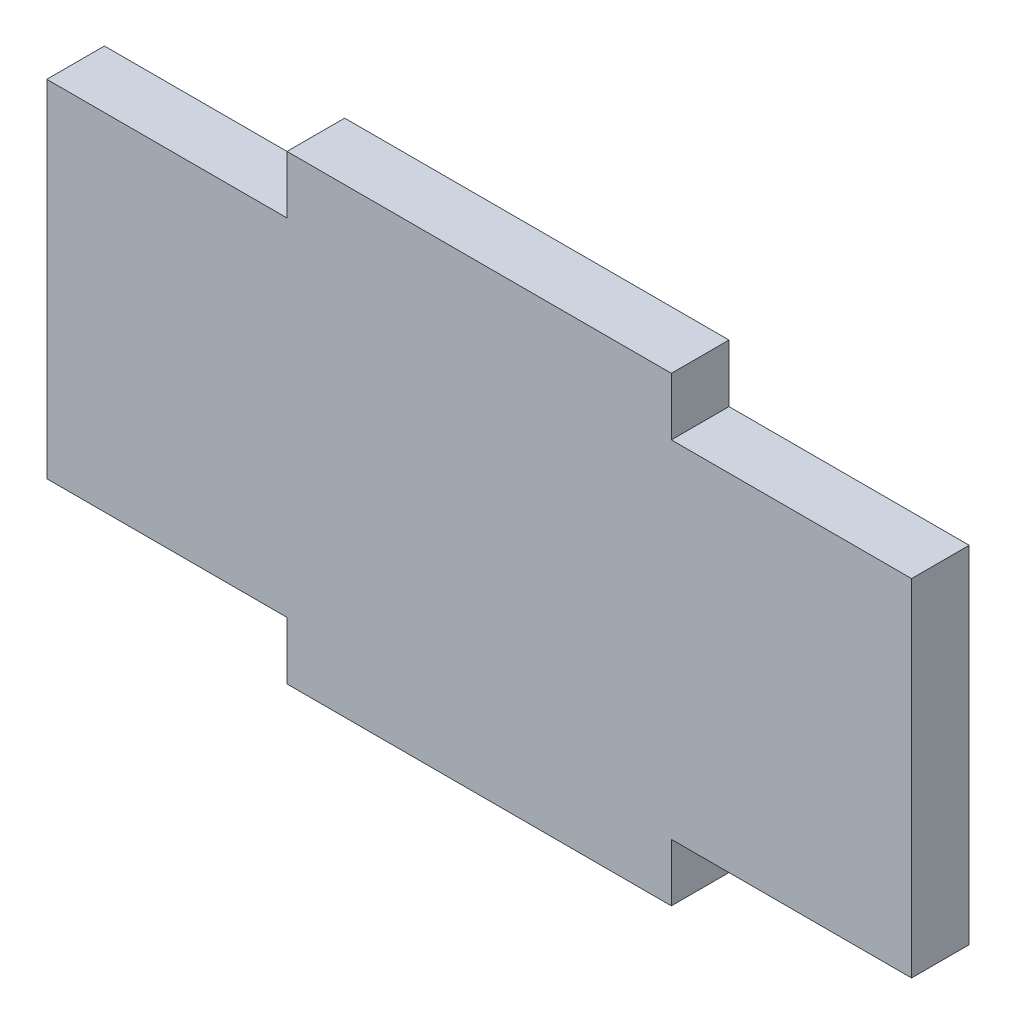
from build123d import *

# Parameters (mm, degrees)
RESSALTO_EXTRUS_O1_DEPTH = 3


with BuildPart() as part:
    # Esboço1 → Ressalto-extrusão1 (new body)
    with BuildSketch(Plane.XY):
        Polygon((-22.5, 9), (-22.5, -9), (-10, -9), (-10, -12), (10, -12), (10, -9), (22.5, -9), (22.5, 9), (10, 9), (10, 12), (-10, 12), (-10, 9), align=None)
    extrude(amount=RESSALTO_EXTRUS_O1_DEPTH)


solid = part.part
